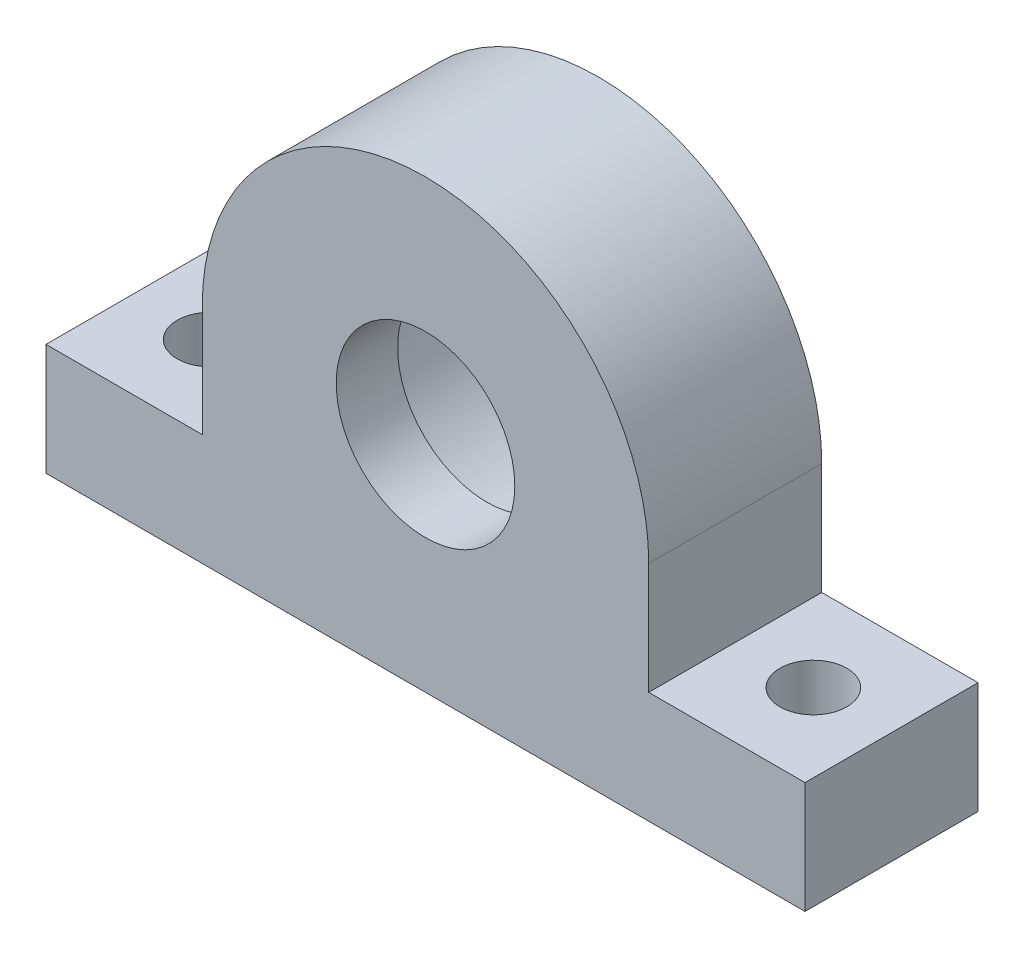
from build123d import *

# Parameters (mm, degrees)
SKETCH1_R           = 13.1
BOSS_EXTRUDE1_DEPTH = 10
SKETCH2_R           = 8
BOSS_EXTRUDE2_DEPTH = 5.5
SKETCH3_R           = 3
CUT_EXTRUDE1_DEPTH  = 48.919202831


with BuildPart() as part:
    # Sketch1 → Boss-Extrude1 (new body)
    with BuildSketch(Plane.XY):
        with BuildLine():
            Line((-34, 0), (34, 0))
            Line((34, 0), (34, 10))
            Line((34, 10), (20, 10))
            Line((20, 10), (20, 20))
            ThreePointArc((20, 20), (0, 40), (-20, 20))
            Line((-20, 20), (-20, 10))
            Line((-20, 10), (-34, 10))
            Line((-34, 10), (-34, 0))
        make_face()
        with Locations((0, 20)):
            Circle(SKETCH1_R, mode=Mode.SUBTRACT)
    extrude(amount=BOSS_EXTRUDE1_DEPTH)

    # Sketch2 → Boss-Extrude2 (add)
    with BuildSketch(Plane.XY.offset(10)):
        with BuildLine():
            Line((34, 0), (34, 10))
            Line((34, 10), (20, 10))
            Line((20, 10), (20, 20))
            ThreePointArc((20, 20), (0, 40), (-20, 20))
            Line((-20, 20), (-20, 10))
            Line((-20, 10), (-34, 10))
            Line((-34, 10), (-34, 0))
            Line((-34, 0), (34, 0))
        make_face()
        with Locations((0, 20)):
            Circle(SKETCH2_R, mode=Mode.SUBTRACT)
    extrude(amount=BOSS_EXTRUDE2_DEPTH)

    # Sketch3 → Cut-Extrude1 (cut, through all)
    with BuildSketch(Plane(origin=(0, 10, 0), x_dir=(1, 0, 0), z_dir=(0, 1, 0))):
        with Locations((27, -7.75)):
            Circle(SKETCH3_R)
        with Locations((-27, -7.75)):
            Circle(SKETCH3_R)
    extrude(amount=-CUT_EXTRUDE1_DEPTH, mode=Mode.SUBTRACT)


solid = part.part
